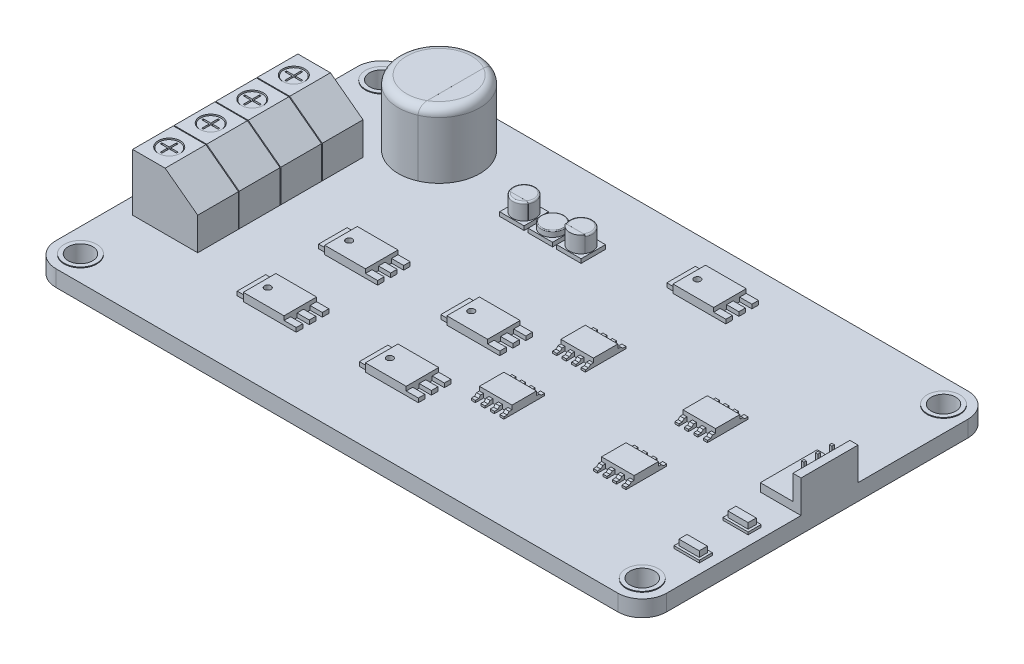
from build123d import *

# Parameters (mm, degrees)
SKETCH1_R              = 1.5000000000000042
BOSS_EXTRUDE1_DEPTH    = 2
BOSS_EXTRUDE3_DEPTH    = 5
SKETCH9_R              = 1.3499999999999985
SKETCH9_R_2            = 1.2499999999999971
CUT_EXTRUDE2_DEPTH     = 2.5
SKETCH9_4_R            = 1.2499999999999971
CUT_EXTRUDE4_DEPTH     = 0.1
CUT_EXTRUDE3_DEPTH     = 0.5
LPATTERN1_COUNT        = 2
LPATTERN1_PITCH        = 5.1
LPATTERN1_COL_COUNT    = 3
LPATTERN1_COL_PITCH    = 5.1
SKETCH10_R             = 2.0000000000000036
SKETCH10_R_2           = 1.5000000000000109
BOSS_EXTRUDE4_DEPTH    = 0.1
SKETCH11_R             = 5.000000000000001
BOSS_EXTRUDE5_DEPTH    = 8
FILLET1_R              = 1
SKETCH12_W             = 5
SKETCH12_H             = 4
SKETCH12_R             = 0.4000000000000013
BOSS_EXTRUDE6_DEPTH    = 1
BOSS_EXTRUDE7_DEPTH    = 0.5
SKETCH13_W             = 3.499999999999999
SKETCH13_H             = 0.5025199044534929
BOSS_EXTRUDE8_DEPTH    = 1
LPATTERN3_COUNT        = 2
LPATTERN3_PITCH        = 10
LPATTERN3_COUNT_DIR2   = 2
LPATTERN3_PITCH_DIR2   = 15
CUT_EXTRUDE5_START     = -8
CUT_EXTRUDE5_DEPTH     = 8
BOSS_EXTRUDE9_DEPTH    = 8
FILLET2_R              = 1
SKETCH16_W             = 5.000000000000002
SKETCH16_H             = 3.9999999999999982
SKETCH16_R             = 0.39999999999999986
BOSS_EXTRUDE10_DEPTH   = 1
SKETCH16_3_W           = 1.5
SKETCH16_3_H           = 0.7999999999999972
SKETCH16_3_H_2         = 0.8000000000000025
BOSS_EXTRUDE11_DEPTH   = 0.5
SKETCH17_W             = 3.4999999999999982
SKETCH17_H             = 0.49999999999999956
BOSS_EXTRUDE12_DEPTH   = 1
BOSS_EXTRUDE13_DEPTH   = 1
SKETCH18_3_W           = 0.5000000000000009
SKETCH18_3_H           = 0.9999999999999987
SKETCH18_3_H_2         = 0.9999999999999991
SKETCH18_3_W_2         = 0.5
BOSS_EXTRUDE14_DEPTH   = 0.5
CUT_EXTRUDE6_REACH     = 54.197
LPATTERN4_COUNT        = 2
LPATTERN4_PITCH        = 10
LPATTERN4_COUNT_DIR2   = 2
LPATTERN4_PITCH_DIR2   = 15
SKETCH20_W             = 2.9999999999999982
SKETCH20_H             = 2.9999999999999982
BOSS_EXTRUDE15_DEPTH   = 0.5
LPATTERN5_COUNT        = 3
LPATTERN5_PITCH        = 3.5
SKETCH21_R             = 1.3999999999999992
BOSS_EXTRUDE16_DEPTH   = 2
CUT_EXTRUDE7_START     = -2
CUT_EXTRUDE7_DEPTH     = 2
BOSS_EXTRUDE17_START   = -2
BOSS_EXTRUDE17_DEPTH   = 2
FILLET3_R              = 0.2
FILLET4_R              = 0.2
LPATTERN6_COUNT        = 2
LPATTERN6_PITCH        = 7
FILLET4_OF_LPATTERN6_R = 0.2
SKETCH24_R             = 1.3999999999999992
BOSS_EXTRUDE18_DEPTH   = 0.7
FILLET5_R              = 0.1
SKETCH25_W             = 5
SKETCH25_H             = 6.999999999999986
BOSS_EXTRUDE19_DEPTH   = 1
SKETCH26_W             = 1
SKETCH26_H             = 6.999999999999984
BOSS_EXTRUDE20_DEPTH   = 3
BOSS_EXTRUDE21_DEPTH   = 3
SKETCH28_W             = 2.500000000000007
SKETCH28_H             = 1
BOSS_EXTRUDE22_DEPTH   = 1
SKETCH29_W             = 3.1000000000000014
SKETCH29_H             = 1.5999999999999996
BOSS_EXTRUDE23_DEPTH   = 0.3
LPATTERN7_COUNT        = 2
LPATTERN7_PITCH        = 6


with BuildPart() as part:
    # Sketch1 → Boss-Extrude1 (new body)
    with BuildSketch(Plane(origin=(0, 0, 0), x_dir=(1, 0, 0), z_dir=(0, 1, 0))):
        with BuildLine():
            Line((34.5, -21.5), (-34.499999999999986, -21.500000000000004))
            ThreePointArc((-34.499999999999986, -21.500000000000004), (-36.62132034355963, -20.621320343559645), (-37.49999999999999, -18.500000000000004))
            Line((-37.49999999999999, -18.500000000000004), (-37.49999999999999, 18.499999999999996))
            ThreePointArc((-37.49999999999999, 18.499999999999996), (-36.621320343559624, 20.62132034355964), (-34.499999999999986, 21.499999999999993))
            Line((-34.499999999999986, 21.499999999999993), (34.5, 21.5))
            ThreePointArc((34.5, 21.5), (36.621320343559645, 20.621320343559653), (37.50000000000001, 18.500000000000004))
            Line((37.50000000000001, 18.500000000000004), (37.50000000000001, -18.499999999999996))
            ThreePointArc((37.50000000000001, -18.499999999999996), (36.621320343559645, -20.621320343559642), (34.5, -21.5))
        make_face()
        with Locations(Location((-34.49999999999999, 18.5, 0), (0, 0, 270))):
            Circle(SKETCH1_R, mode=Mode.SUBTRACT)
        with Locations(Location((34.50000000000001, 18.5, 0), (0, 0, 270))):
            Circle(SKETCH1_R, mode=Mode.SUBTRACT)
        with Locations(Location((34.50000000000001, -18.5, 0), (0, 0, 270))):
            Circle(SKETCH1_R, mode=Mode.SUBTRACT)
        with Locations(Location((-34.49999999999999, -18.5, 0), (0, 0, 270))):
            Circle(SKETCH1_R, mode=Mode.SUBTRACT)
    extrude(amount=BOSS_EXTRUDE1_DEPTH)

    # Sketch8 → Boss-Extrude3 (add)
    with BuildSketch(Plane.XY.offset(1)):
        Polygon((-35.49999999999999, 2), (-35.49999999999999, 9.000000000000002), (-31.499999999999986, 9.000000000000002), (-27.49999999999999, 6), (-27.49999999999999, 2), align=None)
    boss_extrude3 = extrude(amount=BOSS_EXTRUDE3_DEPTH)

    # Sketch9 → Cut-Extrude2 (cut)
    with BuildSketch(Plane(origin=(0, 9.000000000000002, 0), x_dir=(1, 0, 0), z_dir=(0, 1, 0))):
        with Locations(Location((-33.499999999999986, -3.5, 0), (0, 0, 270))):
            Circle(SKETCH9_R)
        with Locations(Location((-33.499999999999986, -3.5, 0), (0, 0, 270))):
            Circle(SKETCH9_R_2, mode=Mode.SUBTRACT)
    cut_extrude2 = extrude(amount=-CUT_EXTRUDE2_DEPTH, mode=Mode.SUBTRACT)

    # Sketch9<4> → Cut-Extrude4 (cut)
    with BuildSketch(Plane(origin=(0, 9.000000000000002, 0), x_dir=(1, 0, 0), z_dir=(0, 1, 0))):
        with Locations(Location((-33.499999999999986, -3.5, 0), (0, 0, 270))):
            Circle(SKETCH9_4_R)
    cut_extrude4 = extrude(amount=-CUT_EXTRUDE4_DEPTH, mode=Mode.SUBTRACT)

    # Sketch9<3> → Cut-Extrude3 (cut)
    with BuildSketch(Plane(origin=(0, 9.000000000000002, 0), x_dir=(1, 0, 0), z_dir=(0, 1, 0))):
        Polygon((-33.399999999999984, -4.500000000000001), (-33.399999999999984, -3.5), (-33.399999999999984, -2.5), (-33.599999999999994, -2.5), (-33.599999999999994, -3.5), (-33.599999999999994, -4.500000000000001), align=None)
        Polygon((-32.499999999999986, -3.4000000000000004), (-34.499999999999986, -3.400000000000001), (-34.499999999999986, -3.6000000000000005), (-32.499999999999986, -3.6), align=None)
    cut_extrude3 = extrude(amount=-CUT_EXTRUDE3_DEPTH, mode=Mode.SUBTRACT)

    # LPattern1: Boss-Extrude3, Cut-Extrude2, Cut-Extrude4, Cut-Extrude3 ×2
    with Locations(*[(0, 0, i * LPATTERN1_PITCH) for i in range(1, LPATTERN1_COUNT)]):
        add(boss_extrude3)
        add(cut_extrude2, mode=Mode.SUBTRACT)
        add(cut_extrude4, mode=Mode.SUBTRACT)
        add(cut_extrude3, mode=Mode.SUBTRACT)

    # LPattern1 col: Boss-Extrude3, Cut-Extrude2, Cut-Extrude4, Cut-Extrude3 ×3
    with Locations(*[(0, 0, -i * LPATTERN1_COL_PITCH) for i in range(1, LPATTERN1_COL_COUNT)]):
        add(boss_extrude3)
        add(cut_extrude2, mode=Mode.SUBTRACT)
        add(cut_extrude4, mode=Mode.SUBTRACT)
        add(cut_extrude3, mode=Mode.SUBTRACT)

    # Sketch10 → Boss-Extrude4 (add)
    # profile 1 of 4: a face of its own
    with BuildSketch(Plane(origin=(0, 2, 0), x_dir=(1, 0, 0), z_dir=(0, 1, 0))):
        with Locations(Location((-34.49999999999999, 18.5, 0), (0, 0, 90))):
            Circle(SKETCH10_R)
        with Locations(Location((-34.49999999999999, 18.5, 0), (0, 0, 270))):
            Circle(SKETCH10_R_2, mode=Mode.SUBTRACT)
    # profile 2 of 4: a face of its own
    with BuildSketch(Plane(origin=(0, 2, 0), x_dir=(1, 0, 0), z_dir=(0, 1, 0))):
        with Locations(Location((34.50000000000001, 18.5, 0), (0, 0, 90))):
            Circle(SKETCH10_R)
        with Locations(Location((34.50000000000001, 18.5, 0), (0, 0, 270))):
            Circle(SKETCH10_R_2, mode=Mode.SUBTRACT)
    # profile 3 of 4: a face of its own
    with BuildSketch(Plane(origin=(0, 2, 0), x_dir=(1, 0, 0), z_dir=(0, 1, 0))):
        with Locations(Location((34.50000000000001, -18.5, 0), (0, 0, 90))):
            Circle(SKETCH10_R)
        with Locations(Location((34.50000000000001, -18.5, 0), (0, 0, 270))):
            Circle(SKETCH10_R_2, mode=Mode.SUBTRACT)
    # profile 4 of 4: a face of its own
    with BuildSketch(Plane(origin=(0, 2, 0), x_dir=(1, 0, 0), z_dir=(0, 1, 0))):
        with Locations(Location((-34.49999999999999, -18.5, 0), (0, 0, 90))):
            Circle(SKETCH10_R)
        with Locations(Location((-34.49999999999999, -18.5, 0), (0, 0, 270))):
            Circle(SKETCH10_R_2, mode=Mode.SUBTRACT)
    extrude(amount=BOSS_EXTRUDE4_DEPTH)

    # Sketch11 → Boss-Extrude5 (add)
    with BuildSketch(Plane(origin=(0, 2, 0), x_dir=(1, 0, 0), z_dir=(0, 1, 0))):
        with Locations(Location((-23.5926967709581, 14.64136917506309, 0), (0, 0, 90))):
            Circle(SKETCH11_R)
    extrude(amount=BOSS_EXTRUDE5_DEPTH)

    # Fillet1
    fillet1_edges = [part.edges().sort_by_distance(p)[0] for p in [
        (-23.5926967709581, 10, -9.64136917506309),
    ]]
    fillet(fillet1_edges, radius=FILLET1_R)

    # Sketch12 → Boss-Extrude6 (add)
    with BuildSketch(Plane(origin=(0, 2, 0), x_dir=(1, 0, 0), z_dir=(0, 1, 0))):
        with Locations((-16.999999999999993, -1.5000000000000067)):
            Rectangle(SKETCH12_W, SKETCH12_H)
        with Locations(Location((-18.499999999999993, -1.5000000000000064, 0), (0, 0, 270))):
            Circle(SKETCH12_R, mode=Mode.SUBTRACT)
    boss_extrude6 = extrude(amount=BOSS_EXTRUDE6_DEPTH)

    # Sketch12<3> → Boss-Extrude7 (add)
    with BuildSketch(Plane(origin=(0, 2, 0), x_dir=(1, 0, 0), z_dir=(0, 1, 0))):
        Polygon((-12.999999999999993, 0.4999999999999935), (-14.499999999999993, 0.4999999999999935), (-14.499999999999993, -0.30098262201832426), (-12.999999999999995, -0.300982622018324), align=None)
        Polygon((-14.499999999999993, -1.1009826220183245), (-14.499999999999993, -1.9009826220183244), (-12.999999999999995, -1.9009826220183244), (-12.999999999999993, -1.1009826220183243), align=None)
        Polygon((-14.499999999999993, -2.7000000000000073), (-14.499999999999993, -3.5000000000000067), (-12.999999999999993, -3.5000000000000067), (-12.999999999999993, -2.700000000000007), align=None)
    boss_extrude7 = extrude(amount=BOSS_EXTRUDE7_DEPTH)

    # Sketch13 → Boss-Extrude8 (add)
    with BuildSketch(Plane.ZY.offset(19.499999999999993)):
        with Locations((1.5000000000000062, 2.2512599522267465)):
            Rectangle(SKETCH13_W, SKETCH13_H)
    boss_extrude8 = extrude(amount=BOSS_EXTRUDE8_DEPTH)

    # LPattern3: Boss-Extrude6, Boss-Extrude7, Boss-Extrude8 2 × 2
    with Locations(*[(j * LPATTERN3_PITCH_DIR2, 0, i * LPATTERN3_PITCH) for i in range(LPATTERN3_COUNT) for j in range(LPATTERN3_COUNT_DIR2) if (i, j) != (0, 0)]):
        add(boss_extrude6)
        add(boss_extrude7)
        add(boss_extrude8)

    # Sketch14 → Cut-Extrude5 (cut)
    with BuildSketch(Plane(origin=(0, 10, 0), x_dir=(1, 0, 0), z_dir=(0, 1, 0)).offset(CUT_EXTRUDE5_START)):
        with BuildLine():
            ThreePointArc((-18.5926967709581, 14.64136917506309), (-19.40939663828772, 17.37998196258892), (-21.592696770958096, 19.22394487001893))
            Line((-21.592696770958096, 19.22394487001893), (-21.592696770958096, 10.058793480107253))
            ThreePointArc((-21.592696770958096, 10.058793480107251), (-19.40939663828772, 11.90275638753726), (-18.5926967709581, 14.641369175063089))
        make_face()
    extrude(amount=CUT_EXTRUDE5_DEPTH, mode=Mode.SUBTRACT)

    # Sketch15 → Boss-Extrude9 (add)
    with BuildSketch(Plane(origin=(0, 2, 0), x_dir=(1, 0, 0), z_dir=(0, 1, 0))):
        with BuildLine():
            ThreePointArc((-18.5926967709581, 14.64136917506309), (-19.409097841806307, 17.3795254890817), (-21.59169677095809, 19.22350830433448))
            Line((-21.59169677095809, 19.22350830433448), (-21.59169677095809, 10.059230045791676))
            ThreePointArc((-21.591696770958123, 10.059230045791686), (-19.409097841806314, 11.903212861044466), (-18.5926967709581, 14.641369175063089))
        make_face()
    extrude(amount=BOSS_EXTRUDE9_DEPTH)

    # Fillet2
    fillet2_edges = [part.edges().sort_by_distance(p)[0] for p in [
        (-18.5926967709581, 10, -14.641369175063078),
    ]]
    fillet(fillet2_edges, radius=FILLET2_R)

    # Sketch16 → Boss-Extrude10 (add)
    with BuildSketch(Plane(origin=(0, 2, 0), x_dir=(1, 0, 0), z_dir=(0, 1, 0))):
        with Locations((8.5, 15.766959703242378)):
            Rectangle(SKETCH16_W, SKETCH16_H)
        with Locations(Location((7, 15.766959703242378, 0), (0, 0, 270))):
            Circle(SKETCH16_R, mode=Mode.SUBTRACT)
    extrude(amount=BOSS_EXTRUDE10_DEPTH)

    # Sketch16<3> → Boss-Extrude11 (add)
    with BuildSketch(Plane(origin=(0, 2, 0), x_dir=(1, 0, 0), z_dir=(0, 1, 0))):
        with Locations((11.750000000000002, 17.36695970324238)):
            Rectangle(SKETCH16_3_W, SKETCH16_3_H)
        with Locations((11.750000000000002, 15.766959703242382)):
            Rectangle(SKETCH16_3_W, SKETCH16_3_H_2)
        with Locations((11.750000000000002, 14.16695970324238)):
            Rectangle(SKETCH16_3_W, SKETCH16_3_H_2)
    extrude(amount=BOSS_EXTRUDE11_DEPTH)

    # Sketch17 → Boss-Extrude12 (add)
    with BuildSketch(Plane.ZY.offset(-6)):
        with Locations((-15.766959703242378, 2.25)):
            Rectangle(SKETCH17_W, SKETCH17_H)
    extrude(amount=BOSS_EXTRUDE12_DEPTH)

    # Sketch18 → Boss-Extrude13 (add)
    with BuildSketch(Plane(origin=(0, 2, 0), x_dir=(1, 0, 0), z_dir=(0, 1, 0))):
        Polygon((9.000000000000002, 4), (9.000000000000002, 0.9999999999999983), (5, 0.9999999999999991), (5.000000000000001, 4), align=None)
    boss_extrude13 = extrude(amount=BOSS_EXTRUDE13_DEPTH)

    # Sketch18<3> → Boss-Extrude14 (add)
    with BuildSketch(Plane(origin=(0, 2, 0), x_dir=(1, 0, 0), z_dir=(0, 1, 0))):
        Polygon((9.000000000000002, 0.9999999999999983), (8.500000000000002, 0.9999999999999984), (8.500000000000002, 0), (9.000000000000002, 0), align=None)
        with Locations((7.583333333333336, 0.49999999999999933)):
            Rectangle(SKETCH18_3_W, SKETCH18_3_H)
        Polygon((6.663333333333336, 0.9999999999999988), (6.163333333333335, 0.9999999999999989), (6.163333333333335, 0), (6.663333333333336, 0), align=None)
        Polygon((5.500000000000003, 0.999999999999999), (5, 0.9999999999999991), (5, 0), (5.500000000000003, 0), align=None)
        Polygon((8.5, 4.999999999999999), (8.500000000000002, 4), (9.000000000000002, 4), (9.000000000000002, 4.999999999999999), align=None)
        with Locations((7.583333333333336, 4.5)):
            Rectangle(SKETCH18_3_W, SKETCH18_3_H_2)
        with Locations((6.413333333333336, 4.5)):
            Rectangle(SKETCH18_3_W_2, SKETCH18_3_H_2)
        Polygon((5.000000000000001, 4.999999999999999), (5.000000000000001, 4), (5.500000000000003, 4), (5.500000000000002, 4.999999999999999), align=None)
    boss_extrude14 = extrude(amount=BOSS_EXTRUDE14_DEPTH)

    # Cut-Extrude6: up to this face of the body (flat: up to its plane)
    cut_extrude6_end = Plane(part.part.faces().sort_by_distance((5, 2.25, -15.766959703))[0])
    # Sketch19 → Cut-Extrude6 (cut, up to the picked face)
    with BuildSketch(Plane(origin=(9.000000000000002, 0, 0), x_dir=(0, 0, -1), z_dir=(1, 0, 0)), mode=Mode.PRIVATE) as cut_extrude6_sk1:
        Polygon((0.6524171441928804, 2.4999999999999973), (0, 2.5), (0, 2.2500000000000004), (0.40241714419288027, 2.2500000000000004), align=None)
    cut_extrude6_tool1 = split(extrude(cut_extrude6_sk1.sketch, amount=-CUT_EXTRUDE6_REACH, mode=Mode.PRIVATE), bisect_by=cut_extrude6_end, keep=Keep.BOTH, mode=Mode.PRIVATE)
    # Sketch19 → Cut-Extrude6 (cut, up to the picked face)
    with BuildSketch(Plane(origin=(9.000000000000002, 0, 0), x_dir=(0, 0, -1), z_dir=(1, 0, 0)), mode=Mode.PRIVATE) as cut_extrude6_sk2:
        Polygon((4.347582855807117, 2.4999999999999964), (4.597582855807118, 2.250000000000001), (4.999999999999997, 2.250000000000001), (4.999999999999997, 2.5000000000000013), align=None)
    cut_extrude6_tool2 = split(extrude(cut_extrude6_sk2.sketch, amount=-CUT_EXTRUDE6_REACH, mode=Mode.PRIVATE), bisect_by=cut_extrude6_end, keep=Keep.BOTH, mode=Mode.PRIVATE)
    cut_extrude6_1 = cut_extrude6_tool1.solids().sort_by(Axis((9, 2.384875, -0.268646), (-1, 0, 0)))[0]
    add(cut_extrude6_1, mode=Mode.SUBTRACT)
    cut_extrude6_2 = cut_extrude6_tool2.solids().sort_by(Axis((9, 2.384875, -4.731354), (-1, 0, 0)))[0]
    add(cut_extrude6_2, mode=Mode.SUBTRACT)
    cut_extrude6 = cut_extrude6_1 + cut_extrude6_2  # Cut-Extrude6 as one shape, for the pattern or mirror that repeats it

    # LPattern4: Boss-Extrude13, Boss-Extrude14, Cut-Extrude6 2 × 2
    with Locations(*[(j * LPATTERN4_PITCH_DIR2, 0, i * LPATTERN4_PITCH) for i in range(LPATTERN4_COUNT) for j in range(LPATTERN4_COUNT_DIR2) if (i, j) != (0, 0)]):
        add(boss_extrude13)
        add(boss_extrude14)
        add(cut_extrude6, mode=Mode.SUBTRACT)

    # Sketch20 → Boss-Extrude15 (add)
    with BuildSketch(Plane(origin=(0, 2, 0), x_dir=(1, 0, 0), z_dir=(0, 1, 0))):
        with Locations((-11.325032755081622, 12.808773118003046)):
            Rectangle(SKETCH20_W, SKETCH20_H)
    boss_extrude15 = extrude(amount=BOSS_EXTRUDE15_DEPTH)

    # LPattern5: Boss-Extrude15 ×3
    with Locations(*[(i * LPATTERN5_PITCH, 0, 0) for i in range(1, LPATTERN5_COUNT)]):
        add(boss_extrude15)

    # Sketch21 → Boss-Extrude16 (add)
    with BuildSketch(Plane(origin=(0, 2.5, 0), x_dir=(1, 0, 0), z_dir=(0, 1, 0))):
        with Locations(Location((-11.325032755081624, 12.808773118003046, 0), (0, 0, 270))):
            Circle(SKETCH21_R)
    boss_extrude16 = extrude(amount=BOSS_EXTRUDE16_DEPTH)

    # Sketch22 → Cut-Extrude7 (cut)
    with BuildSketch(Plane(origin=(0, 4.500000000000001, 0), x_dir=(1, 0, 0), z_dir=(0, 1, 0)).offset(CUT_EXTRUDE7_START)):
        with BuildLine():
            Line((-10.112597189783411, 12.108773118003047), (-12.537468320379837, 12.108773118003047))
            ThreePointArc((-12.537468320379837, 12.108773118003047), (-11.325032755081624, 11.408773118003047), (-10.112597189783411, 12.108773118003045))
        make_face()
    cut_extrude7 = extrude(amount=CUT_EXTRUDE7_DEPTH, mode=Mode.SUBTRACT)

    # Sketch23 → Boss-Extrude17 (add)
    with BuildSketch(Plane(origin=(0, 4.500000000000001, 0), x_dir=(1, 0, 0), z_dir=(0, 1, 0)).offset(BOSS_EXTRUDE17_START)):
        with BuildLine():
            Line((-10.113175090172087, 12.107773118003047), (-12.536890419991161, 12.107773118003047))
            ThreePointArc((-12.536890419991163, 12.107773118003047), (-11.325032755081624, 11.408773118003047), (-10.113175090172085, 12.107773118003047))
        make_face()
    boss_extrude17 = extrude(amount=BOSS_EXTRUDE17_DEPTH)

    # Fillet3
    fillet3_edges = [part.edges().sort_by_distance(p)[0] for p in [
        (-11.325032755081624, 4.500000000000001, -11.408773118003047),
    ]]
    fillet(fillet3_edges, radius=FILLET3_R)

    # Fillet4
    fillet4_edges = [part.edges().sort_by_distance(p)[0] for p in [
        (-11.325032755081624, 4.5, -14.208773118003045),
    ]]
    fillet(fillet4_edges, radius=FILLET4_R)

    # LPattern6: Boss-Extrude16, Cut-Extrude7, Boss-Extrude17 ×2
    with Locations(*[(i * LPATTERN6_PITCH, 0, 0) for i in range(1, LPATTERN6_COUNT)]):
        add(boss_extrude16)
        add(cut_extrude7, mode=Mode.SUBTRACT)
        add(boss_extrude17)

    # Fillet4 of LPattern6
    fillet4_of_lpattern6_edges = [part.edges().sort_by_distance(p)[0] for p in [
        (-4.325032755081624, 4.5, -14.208773118003045),
    ]]
    fillet(fillet4_of_lpattern6_edges, radius=FILLET4_OF_LPATTERN6_R)

    # Sketch24 → Boss-Extrude18 (add)
    with BuildSketch(Plane(origin=(0, 2.5, 0), x_dir=(1, 0, 0), z_dir=(0, 1, 0))):
        with Locations(Location((-7.825032755081625, 12.808773118003046, 0), (0, 0, 270))):
            Circle(SKETCH24_R)
    extrude(amount=BOSS_EXTRUDE18_DEPTH)

    # Fillet5
    fillet5_edges = [part.edges().sort_by_distance(p)[0] for p in [
        (-7.825032755081625, 3.2, -14.208773118003045),
    ]]
    fillet(fillet5_edges, radius=FILLET5_R)

    # Sketch25 → Boss-Extrude19 (add)
    with BuildSketch(Plane(origin=(0, 2, 0), x_dir=(1, 0, 0), z_dir=(0, 1, 0))):
        with Locations((35.00000000000001, 1.5000000000000073)):
            Rectangle(SKETCH25_W, SKETCH25_H)
    extrude(amount=BOSS_EXTRUDE19_DEPTH)

    # Sketch26 → Boss-Extrude20 (add)
    with BuildSketch(Plane(origin=(0, 3, 0), x_dir=(1, 0, 0), z_dir=(0, 1, 0))):
        with Locations((37.00000000000001, 1.5000000000000078)):
            Rectangle(SKETCH26_W, SKETCH26_H)
    extrude(amount=BOSS_EXTRUDE20_DEPTH)

    # Sketch27 → Boss-Extrude21 (add)
    with BuildSketch(Plane(origin=(0, 3, 0), x_dir=(1, 0, 0), z_dir=(0, 1, 0))):
        Polygon((35.7, 3.58), (36.00000000000001, 3.58), (36.00000000000001, 3.2799999999999985), (35.7, 3.279999999999999), align=None)
        Polygon((35.700000000000024, 1.8633333333333324), (35.700000000000024, 1.563333333333331), (36.00000000000003, 1.5633333333333306), (36.00000000000003, 1.8633333333333324), align=None)
        Polygon((35.70000000000004, 0.1466666666666643), (35.70000000000004, -0.15333333333333693), (36.000000000000036, -0.15333333333333735), (36.000000000000036, 0.1466666666666643), align=None)
    extrude(amount=BOSS_EXTRUDE21_DEPTH)

    # Sketch28 → Boss-Extrude22 (add)
    with BuildSketch(Plane(origin=(0, 2, 0), x_dir=(1, 0, 0), z_dir=(0, 1, 0))):
        with Locations((34.75, -6.499999999999987)):
            Rectangle(SKETCH28_W, SKETCH28_H)
    boss_extrude22 = extrude(amount=BOSS_EXTRUDE22_DEPTH)

    # Sketch29 → Boss-Extrude23 (add)
    with BuildSketch(Plane(origin=(0, 2, 0), x_dir=(1, 0, 0), z_dir=(0, 1, 0))):
        with Locations((34.75, -6.499999999999985)):
            Rectangle(SKETCH29_W, SKETCH29_H)
    boss_extrude23 = extrude(amount=BOSS_EXTRUDE23_DEPTH)

    # LPattern7: Boss-Extrude22, Boss-Extrude23 ×2
    with Locations(*[(0, 0, i * LPATTERN7_PITCH) for i in range(1, LPATTERN7_COUNT)]):
        add(boss_extrude22)
        add(boss_extrude23)


solid = part.part
